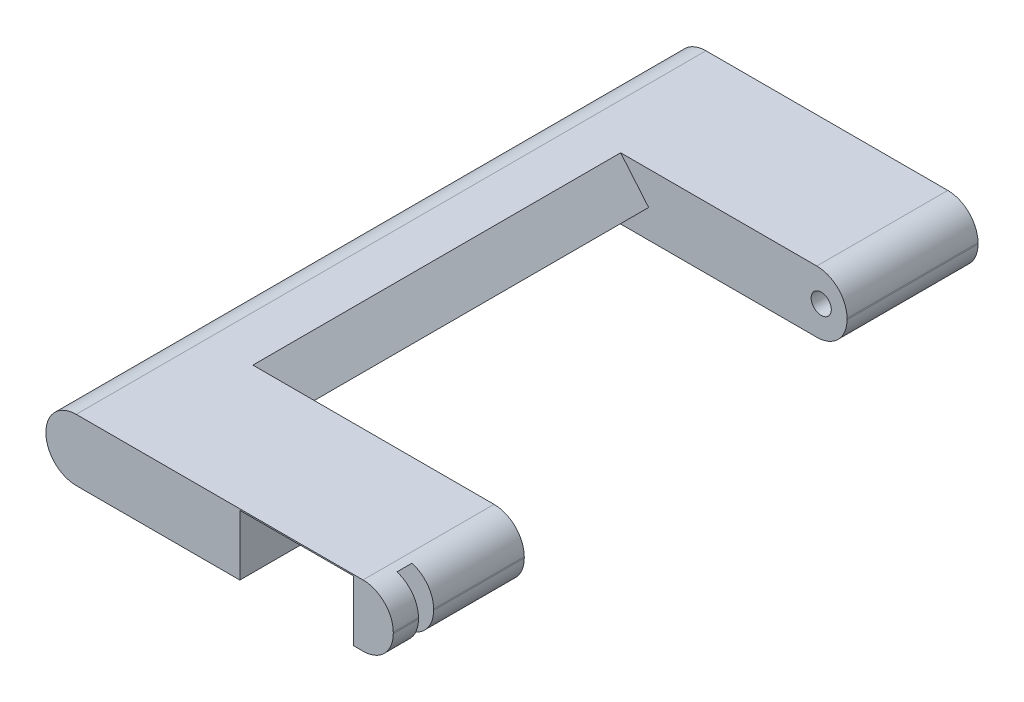
from build123d import *

# Parameters (mm, degrees)
SALIENTE_EXTRUIR1_DEPTH      = 17
SALIENTE_EXTRUIR1_DEPTH_BACK = 9
CROQUIS1_W                   = 68.933075381
CROQUIS1_H                   = 12.253553391
CROQUIS2_W                   = 21.064851014
CROQUIS2_H                   = 12.253553391
SALIENTE_EXTRUIR2_DEPTH      = 99
CROQUIS3_W                   = 60
CROQUIS3_H                   = 12.253553391
SALIENTE_EXTRUIR3_DEPTH      = 26
REDONDEO1_R                  = 6
CHAFL_N1_SIZE                = 6
CHAFL_N1_SIZE_2              = 7.150521556
CORTAR_EXTRUIR1_REACH        = 136.692
CROQUIS5_R                   = 2
REDONDEO2_R                  = 6
CORTAR_EXTRUIR2_DEPTH        = 12


with BuildPart() as part:
    # Croquis1 → Saliente-Extruir1 (new, two sides: drawn at the far end of the back side and taken through both)
    with BuildSketch(Plane.XY.offset(-SALIENTE_EXTRUIR1_DEPTH_BACK)):
        with Locations((-15.316537691, -0.076776695)):
            Rectangle(CROQUIS1_W, CROQUIS1_H)
    extrude(amount=SALIENTE_EXTRUIR1_DEPTH + SALIENTE_EXTRUIR1_DEPTH_BACK)

    # Croquis2 → Saliente-Extruir2 (add)
    with BuildSketch(Plane(origin=(0, 0, -9), x_dir=(-1, 0, 0), z_dir=(0, 0, -1))):
        with Locations((39.250649874, -0.076776695)):
            Rectangle(CROQUIS2_W, CROQUIS2_H)
    extrude(amount=SALIENTE_EXTRUIR2_DEPTH)

    # Croquis3 → Saliente-Extruir3 (add)
    with BuildSketch(Plane(origin=(0, 0, -108), x_dir=(-1, 0, 0), z_dir=(0, 0, -1))):
        with Locations((19.783075381, -0.076776695)):
            Rectangle(CROQUIS3_W, CROQUIS3_H)
    extrude(amount=-SALIENTE_EXTRUIR3_DEPTH)

    # Redondeo1
    redondeo1_edges = [part.edges().sort_by_distance(p)[0] for p in [
        (-49.783075381, 6.05, -45.5),
        (-49.783075381, -6.203553391, -45.5),
    ]]
    fillet(redondeo1_edges, radius=REDONDEO1_R)

    # Chaflán1
    # the kernel refuses this chamfer: 7.150521556, 6 mm, written as the material it takes off along each edge
    with BuildSketch(Plane(origin=(-28.718224367, -6.203553391, -9), x_dir=(0.03540953691366326, 0.9993728857116146, 0), z_dir=(0, 0, -1)), Plane(origin=(-28.718224367, 6.05, -9), x_dir=(-0.9993728857116146, 0.03540953691366412, 0), z_dir=(0, 0, -1))) as chafl_n1_piece_1:
        Polygon((CHAFL_N1_SIZE * 0.999372885712, -CHAFL_N1_SIZE * 0.0354095369137), (-CHAFL_N1_SIZE_2 * 0.0354095369115, -CHAFL_N1_SIZE_2 * 0.999372885651), (0, 0), align=None)
    extrude(amount=73, mode=Mode.SUBTRACT)

    # Croquis5 → Cortar-Extruir1 (cut, up to next)
    with BuildSketch(Plane(origin=(0, 0, -108), x_dir=(-1, 0, 0), z_dir=(0, 0, -1)), mode=Mode.PRIVATE) as cortar_extruir1_sk1:
        with Locations((-5.1, 0)):
            Circle(CROQUIS5_R)
    cortar_extruir1_tool1 = extrude(cortar_extruir1_sk1.sketch, amount=-CORTAR_EXTRUIR1_REACH, mode=Mode.PRIVATE) & part.part
    add(cortar_extruir1_tool1.solids().sort_by_distance((5.1, 0, -108))[0], mode=Mode.SUBTRACT)

    # Redondeo2
    redondeo2_edges = [part.edges().sort_by_distance(p)[0] for p in [
        (10.216924619, 6.05, -95),
        (10.216924619, -6.203553391, -95),
        (19.15, 6.05, 4),
        (19.15, -6.203553391, 4),
    ]]
    fillet(redondeo2_edges, radius=REDONDEO2_R)

    # Croquis6 → Cortar-Extruir2 (cut)
    with BuildSketch(Plane.XZ.offset(6.203553391)):
        Polygon((-11.3, 0.05), (-11.3, 17), (11.3, 17), (11.3, 12), (19.15, 12), (19.15, 9), (11.3, 9), (11.3, 0.05), align=None)
    extrude(amount=-CORTAR_EXTRUIR2_DEPTH, mode=Mode.SUBTRACT)


solid = part.part
